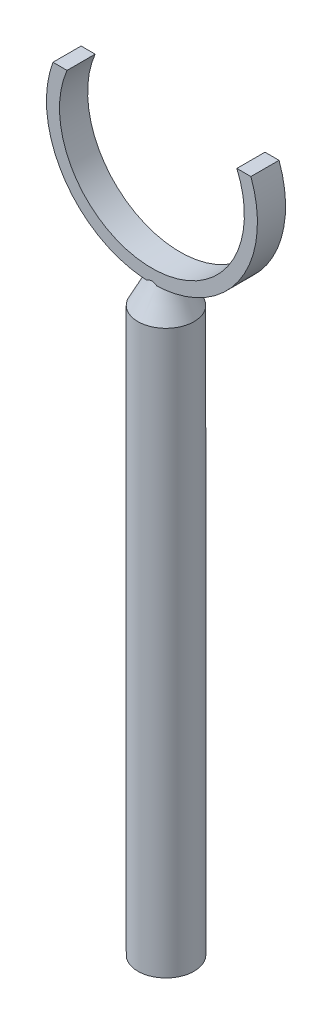
from build123d import *

# Parameters (mm, degrees)
SKETCH_1_R           = 10
EXTRUDE_1_DEPTH      = 200
EXTRUDE_2_DEPTH      = 5
EXTRUDE_2_DEPTH_BACK = 5


with BuildPart() as part:
    # Эскиз1 → Бобышка-Вытянуть1 (new body)
    with BuildSketch(Plane(origin=(0, 0, 0), x_dir=(1, 0, 0), z_dir=(0, 1, 0))):
        with Locations(Location((0, 0, 0), (0, 0, 270))):
            Circle(SKETCH_1_R)
    extrude(amount=EXTRUDE_1_DEPTH)

    # По сечениям1: read off the stored shape, not the designer's step
    # По сечениям1: loft between two sections, ruled curve by curve
    loft_1_from = [
        Edge.make_bspline([(0.941083133, 200, 9.955619646), (20.852322425, 200, 8.07345338), (18.970156159, 200, -11.837785912), (-0.941083133, 200, -9.955619646), (-20.852322425, 200, -8.07345338), (-18.970156159, 200, 11.837785912), (0.941083133, 200, 9.955619646)], [0, 0, 0, 0, 0.5, 0.5, 0.5, 1, 1, 1, 1], 3, [1, 0.333333333, 0.333333333, 1, 0.333333333, 0.333333333, 1]),
    ]
    loft_1_to = [
        Edge.make_bspline([(1.846463267, 210, 4.646565765), (11.139594796, 210, 0.953639232), (7.446668263, 210, -8.339492298), (-1.846463267, 210, -4.646565765), (-11.139594796, 210, -0.953639232), (-7.446668263, 210, 8.339492298), (1.846463267, 210, 4.646565765)], [0, 0, 0, 0, 0.5, 0.5, 0.5, 1, 1, 1, 1], 3, [1, 0.333333333, 0.333333333, 1, 0.333333333, 0.333333333, 1]),
    ]
    loft_1 = Solid(Shell([*[Face.make_surface_from_curves(loft_1_from[k], loft_1_to[k]) for k in range(1)], Face(Wire(loft_1_from)), Face(Wire(loft_1_to))]))
    add(loft_1)


with BuildPart() as body_2:
    # Эскиз8 → Бобышка-Вытянуть2 (new, two sides: drawn at the far end of the back side and taken through both)
    with BuildSketch(Plane.XY.offset(-EXTRUDE_2_DEPTH_BACK)):
        with BuildLine():
            Line((-35.180049217, 259.748056851), (-30.180049217, 259.748056851))
            ThreePointArc((-30.180049217, 259.748056851), (0, 213.906800526), (30.180049217, 259.748056851))
            Line((30.180049217, 259.748056851), (35.180049217, 259.748056851))
            ThreePointArc((35.180049217, 259.748056851), (0, 209.261817044), (-35.180049217, 259.748056851))
        make_face()
    extrude(amount=EXTRUDE_2_DEPTH + EXTRUDE_2_DEPTH_BACK)


solid = Compound([part.part, body_2.part])
